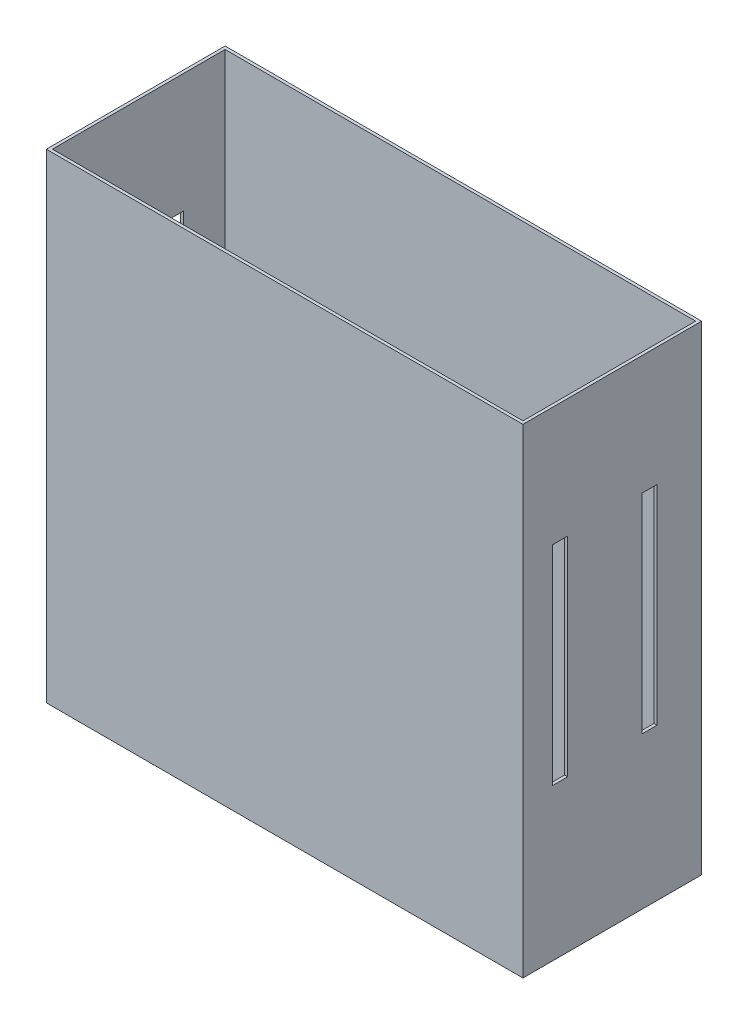
from build123d import *

# Parameters (mm, degrees)
SKETCH1_W               = 406.4
SKETCH1_H               = 152.4
SKETCH1_W_2             = 401.32
SKETCH1_H_2             = 147.32
BOSS_EXTRUDE1_DEPTH     = 406.4
SKETCH2_W               = 406.4
SKETCH2_H               = 152.4
BOSS_EXTRUDE2_DEPTH     = 2.54
CUT_EXTRUDE1_DEPTH      = 580.765780294
CUT_EXTRUDE1_DEPTH_BACK = 580.765780294
SKETCH3_W               = 12.7
SKETCH3_H               = 177.8


with BuildPart() as part:
    # Sketch1 → Boss-Extrude1 (new body)
    with BuildSketch(Plane(origin=(0, 0, 0), x_dir=(1, 0, 0), z_dir=(0, 1, 0))):
        Rectangle(SKETCH1_W, SKETCH1_H)
        Rectangle(SKETCH1_W_2, SKETCH1_H_2, mode=Mode.SUBTRACT)
    extrude(amount=BOSS_EXTRUDE1_DEPTH)

    # Sketch2 → Boss-Extrude2 (add)
    with BuildSketch(Plane.XZ):
        Rectangle(SKETCH2_W, SKETCH2_H)
    extrude(amount=BOSS_EXTRUDE2_DEPTH)

    # Sketch3 → Cut-Extrude1 (cut, two sides: drawn at the far end of the back side and taken through both)
    with BuildSketch(Plane.ZY.offset(203.2).offset(-CUT_EXTRUDE1_DEPTH_BACK)):
        with Locations((44.45, 215.9)):
            Rectangle(SKETCH3_W, SKETCH3_H)
        with Locations((-31.75, 215.9)):
            Rectangle(SKETCH3_W, SKETCH3_H)
    extrude(amount=CUT_EXTRUDE1_DEPTH + CUT_EXTRUDE1_DEPTH_BACK, mode=Mode.SUBTRACT)


solid = part.part
